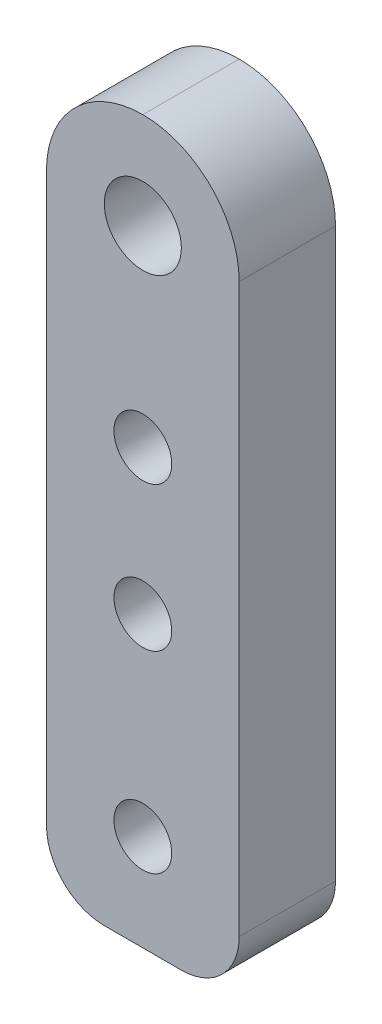
from build123d import *

# Parameters (mm, degrees)
SKETCH_1_W      = 10
SKETCH_1_H      = 37.45
SKETCH_1_R      = 1.5
SKETCH_1_R_2    = 2
EXTRUDE_1_DEPTH = 5
FILLET_1_R      = 5
FILLET_2_R      = 3


with BuildPart() as part:
    # ｽｹｯﾁ1 → ﾎﾞｽ - 押し出し1 (new body)
    with BuildSketch(Plane.XY):
        Rectangle(SKETCH_1_W, SKETCH_1_H)
        with Locations((0, -13.725)):
            Circle(SKETCH_1_R, mode=Mode.SUBTRACT)
        with Locations((0, -3.725)):
            Circle(SKETCH_1_R, mode=Mode.SUBTRACT)
        with Locations((0, 13.725)):
            Circle(SKETCH_1_R_2, mode=Mode.SUBTRACT)
        with Locations((0, 3.775)):
            Circle(SKETCH_1_R, mode=Mode.SUBTRACT)
    extrude(amount=EXTRUDE_1_DEPTH)

    # ﾌｨﾚｯﾄ1
    fillet_1_edges = [part.edges().sort_by_distance(p)[0] for p in [
        (5, 18.725, 2.5),
        (-5, 18.725, 2.5),
    ]]
    fillet(fillet_1_edges, radius=FILLET_1_R - 0.0001)  # a hair under: the kernel refuses the full size

    # ﾌｨﾚｯﾄ2
    fillet_2_edges = [part.edges().sort_by_distance(p)[0] for p in [
        (5, -18.725, 2.5),
        (-5, -18.725, 2.5),
    ]]
    fillet(fillet_2_edges, radius=FILLET_2_R)


solid = part.part
